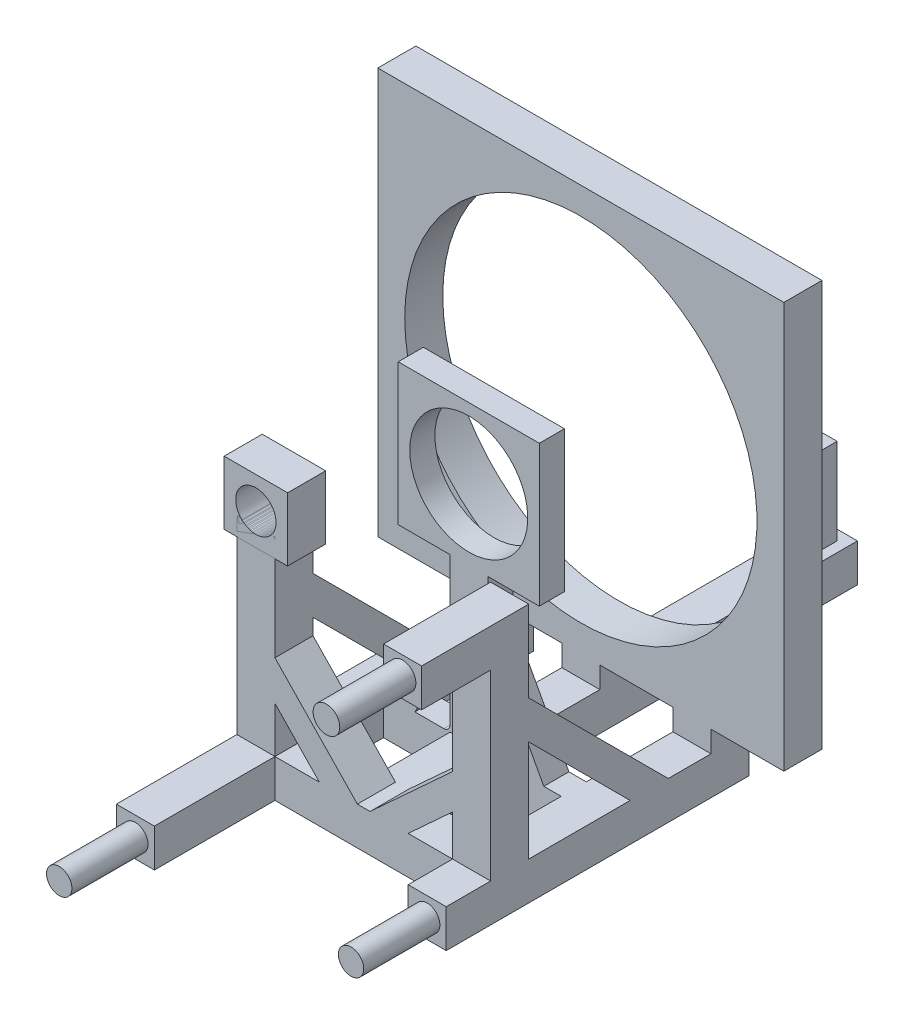
from build123d import *

# Parameters (mm, degrees)
SKETCH3_W            = 3
SKETCH3_H            = 3
SKETCH7_W            = 3
SKETCH7_H            = 3
BOSS_EXTRUDE1_DEPTH  = 16.5
SKETCH12_W           = 5
SKETCH12_H           = 5
BOSS_EXTRUDE4_DEPTH  = 1.5
SKETCH17_R           = 1
BOSS_EXTRUDE5_DEPTH  = 6
SKETCH18_R           = 1
BOSS_EXTRUDE6_DEPTH  = 6
SKETCH19_W           = 3
SKETCH19_H           = 3
BOSS_EXTRUDE7_DEPTH  = 7.54
SKETCH21_W           = 3
SKETCH21_H           = 1.98
BOSS_EXTRUDE8_DEPTH  = 17.68
SKETCH22_W           = 11.12
SKETCH22_H           = 11.12
BOSS_EXTRUDE9_DEPTH  = 0.99
SKETCH23_R           = 4.65
CUT_EXTRUDE2_DEPTH   = 2.5
SKETCH24_W           = 3
SKETCH24_H           = 3
BOSS_EXTRUDE10_DEPTH = 9.83
SKETCH25_W           = 3
SKETCH25_H           = 3
BOSS_EXTRUDE11_DEPTH = 3
SKETCH27_W           = 32
SKETCH27_H           = 32
BOSS_EXTRUDE12_DEPTH = 1.5
SKETCH28_R           = 13.88
CUT_EXTRUDE3_DEPTH   = 7
SKETCH31_W           = 3
SKETCH31_H           = 3
BOSS_EXTRUDE13_DEPTH = 17.3
SKETCH32_W           = 1.4
SKETCH32_H           = 1.4
BOSS_EXTRUDE14_DEPTH = 6.8
SKETCH33_W           = 3
SKETCH33_H           = 3
BOSS_EXTRUDE15_DEPTH = 17.37
SKETCH34_W           = 3
SKETCH34_H           = 3
BOSS_EXTRUDE16_DEPTH = 5.5
SKETCH36_W           = 3
SKETCH36_H           = 3
SKETCH16_R           = 1.59
CUT_EXTRUDE7_DEPTH   = 5
SKETCH41_W           = 3
SKETCH41_H           = 3
BOSS_EXTRUDE17_DEPTH = 17.37
SKETCH42_W           = 3
SKETCH42_H           = 3
BOSS_EXTRUDE18_DEPTH = 5
SKETCH43_W           = 3
SKETCH43_H           = 3
BOSS_EXTRUDE19_DEPTH = 17.4
SKETCH47_W           = 3
SKETCH47_H           = 3
SKETCH53_W           = 3
SKETCH53_H           = 3
BOSS_EXTRUDE20_REACH = 63.391
SKETCH55_W           = 1.98
SKETCH55_H           = 3
BOSS_EXTRUDE21_REACH = 63.391
SKETCH56_W           = 1.98
SKETCH56_H           = 3
FILLET1_R            = 0.5
FILLET2_R            = 0.5
SKETCH57_W           = 1.98
SKETCH57_H           = 3
SKETCH59_W           = 3
SKETCH59_H           = 3
BOSS_EXTRUDE22_DEPTH = 5.44
SKETCH63_R           = 1.05
BOSS_EXTRUDE25_DEPTH = 6


with BuildPart() as part:
    # Sweep3: sweep along a path in Sketch4
    with BuildLine(Plane(origin=(0, 0, 0), x_dir=(1, 0, 0), z_dir=(0, 1, 0))) as sweep3_path:
        Line((0, 0), (0, 11))
        Line((0, 11), (17, 11))
        Line((17, 11), (17, 6))
    # Sketch3 → Sweep3 (sweep)
    with BuildSketch(Plane.XY):
        Rectangle(SKETCH3_W, SKETCH3_H)
    sweep(path=sweep3_path.line, transition=Transition.RIGHT)

    # Sketch7 → Boss-Extrude1 (add)
    with BuildSketch(Plane(origin=(0, 0, 0), x_dir=(1, 0, 0), z_dir=(0, 1, 0))):
        with Locations((0, 11)):
            Rectangle(SKETCH7_W, SKETCH7_H)
    extrude(amount=BOSS_EXTRUDE1_DEPTH)

    # Sketch17 → Boss-Extrude5 (add)
    with BuildSketch(Plane.XY):
        Circle(SKETCH17_R)
    extrude(amount=BOSS_EXTRUDE5_DEPTH)

    # Sketch18 → Boss-Extrude6 (add)
    with BuildSketch(Plane.XY.offset(-6)):
        with Locations((17, 0)):
            Circle(SKETCH18_R)
    extrude(amount=BOSS_EXTRUDE6_DEPTH)

    # Sweep4: sweep along a path in Sketch39
    with BuildLine(Plane.XY.offset(-11)) as sweep4_path:
        Line((6.5, 1.5), (0, 8.24))
    # Sketch36 → Sweep4 (sweep)
    with BuildSketch(Plane(origin=(0, 1.5, 0), x_dir=(1, 0, 0), z_dir=(0, 1, 0))):
        with Locations((6.5, 11)):
            Rectangle(SKETCH36_W, SKETCH36_H)
    sweep(path=sweep4_path.line)


with BuildPart() as body_2:
    # Sketch12 → Boss-Extrude4 (new, symmetric)
    with BuildSketch(Plane.XY.offset(-11)):
        with Locations((0, 17.5)):
            Rectangle(SKETCH12_W, SKETCH12_H)
    extrude(amount=BOSS_EXTRUDE4_DEPTH, both=True)


with BuildPart() as body_3:
    # Sketch19 → Boss-Extrude7 (new body)
    with BuildSketch(Plane.XY.offset(-12.5)):
        with Locations((8.24, 0)):
            Rectangle(SKETCH19_W, SKETCH19_H)
    extrude(amount=-BOSS_EXTRUDE7_DEPTH)

    # Sketch21 → Boss-Extrude8 (add)
    with BuildSketch(Plane(origin=(0, 1.5, 0), x_dir=(1, 0, 0), z_dir=(0, 1, 0))):
        with Locations((8.24, 19.05)):
            Rectangle(SKETCH21_W, SKETCH21_H)
    extrude(amount=BOSS_EXTRUDE8_DEPTH)

    # Sketch22 → Boss-Extrude9 (add, symmetric)
    with BuildSketch(Plane.XY.offset(-19.05)):
        with Locations((8.217064706, 19.179985124)):
            Rectangle(SKETCH22_W, SKETCH22_H)
    extrude(amount=BOSS_EXTRUDE9_DEPTH, both=True)

    # Sketch23 → Cut-Extrude2 (cut, symmetric)
    with BuildSketch(Plane(origin=(0, 0, -20.04), x_dir=(-1, 0, 0), z_dir=(0, 0, -1))):
        with Locations((-8.217064706, 19.179985124)):
            Circle(SKETCH23_R)
    extrude(amount=CUT_EXTRUDE2_DEPTH, both=True, mode=Mode.SUBTRACT)

    # Sketch24 → Boss-Extrude10 (add)
    with BuildSketch(Plane(origin=(0, 0, -20.04), x_dir=(-1, 0, 0), z_dir=(0, 0, -1))):
        with Locations((-8.24, 0)):
            Rectangle(SKETCH24_W, SKETCH24_H)
    extrude(amount=BOSS_EXTRUDE10_DEPTH)

    # Sketch25 → Boss-Extrude11 (add)
    with BuildSketch(Plane(origin=(0, 1.5, 0), x_dir=(1, 0, 0), z_dir=(0, 1, 0))):
        with Locations((8.24, 28.37)):
            Rectangle(SKETCH25_W, SKETCH25_H)
    extrude(amount=BOSS_EXTRUDE11_DEPTH)

    # Sketch27 → Boss-Extrude12 (add, symmetric)
    with BuildSketch(Plane(origin=(0, 0, -28.37), x_dir=(-1, 0, 0), z_dir=(0, 0, -1))):
        with Locations((-8.24, 19.18)):
            Rectangle(SKETCH27_W, SKETCH27_H)
    extrude(amount=BOSS_EXTRUDE12_DEPTH, both=True)

    # Sketch28 → Cut-Extrude3 (cut)
    with BuildSketch(Plane(origin=(0, 0, -29.87), x_dir=(-1, 0, 0), z_dir=(0, 0, -1))):
        with Locations((-8.24, 19.18)):
            Circle(SKETCH28_R)
    extrude(amount=-CUT_EXTRUDE3_DEPTH, mode=Mode.SUBTRACT)

    # Sketch31 → Boss-Extrude13 (add)
    with BuildSketch(Plane(origin=(0, 0, -29.87), x_dir=(-1, 0, 0), z_dir=(0, 0, -1))):
        with Locations((-8.24, 0)):
            Rectangle(SKETCH31_W, SKETCH31_H)
    extrude(amount=BOSS_EXTRUDE13_DEPTH)

    # Sketch32 → Boss-Extrude14 (add)
    with BuildSketch(Plane(origin=(0, 1.5, 0), x_dir=(1, 0, 0), z_dir=(0, 1, 0))):
        with Locations((8.24, 45.67)):
            Rectangle(SKETCH32_W, SKETCH32_H)
    extrude(amount=BOSS_EXTRUDE14_DEPTH)



with BuildPart() as body_4:
    # Sketch33 → Boss-Extrude15 (new body)
    with BuildSketch(Plane(origin=(0, 0, -12.5), x_dir=(-1, 0, 0), z_dir=(0, 0, -1))):
        with Locations((-17, 0)):
            Rectangle(SKETCH33_W, SKETCH33_H)
    extrude(amount=BOSS_EXTRUDE15_DEPTH)

    # Sketch34 → Boss-Extrude16 (add)
    with BuildSketch(Plane(origin=(0, 1.5, 0), x_dir=(1, 0, 0), z_dir=(0, 1, 0))):
        with Locations((17, 28.37)):
            Rectangle(SKETCH34_W, SKETCH34_H)
    extrude(amount=BOSS_EXTRUDE16_DEPTH)


with BuildPart() as cut_extrude7_tool:
    # Sketch16 → Cut-Extrude7 (new, symmetric)
    with BuildSketch(Plane(origin=(0, 0, -12.5), x_dir=(-1, 0, 0), z_dir=(0, 0, -1))):
        with Locations(Location((0, 17.5, 0), (0, 0, 180))):
            Circle(SKETCH16_R)
    extrude(amount=CUT_EXTRUDE7_DEPTH, both=True)


with BuildPart() as part_1:
    add(part.part)

    # Cut-Extrude7: cut by cut_extrude7_tool
    add(cut_extrude7_tool.part, mode=Mode.SUBTRACT)


with BuildPart() as body_2_1:
    add(body_2.part)

    # Cut-Extrude7: cut by cut_extrude7_tool
    add(cut_extrude7_tool.part, mode=Mode.SUBTRACT)


with BuildPart() as body_3_1:
    add(body_3.part)

    add(part_1.part)  # Boss-Extrude17 merges part
    # Sketch41 → Boss-Extrude17 (add)
    with BuildSketch(Plane(origin=(0, 0, -12.5), x_dir=(-1, 0, 0), z_dir=(0, 0, -1))):
        Rectangle(SKETCH41_W, SKETCH41_H)
    extrude(amount=BOSS_EXTRUDE17_DEPTH)

    # Sketch42 → Boss-Extrude18 (add)
    with BuildSketch(Plane(origin=(0, 1.5, 0), x_dir=(1, 0, 0), z_dir=(0, 1, 0))):
        with Locations((0, 28.37)):
            Rectangle(SKETCH42_W, SKETCH42_H)
    extrude(amount=BOSS_EXTRUDE18_DEPTH)


    add(body_4.part)  # Boss-Extrude19 merges body 4
    # Sketch43 → Boss-Extrude19 (add)
    with BuildSketch(Plane(origin=(0, 1.5, 0), x_dir=(1, 0, 0), z_dir=(0, 1, 0))):
        with Locations((17, 11)):
            Rectangle(SKETCH43_W, SKETCH43_H)
    extrude(amount=BOSS_EXTRUDE19_DEPTH)

    # Sweep5: sweep along a path in Sketch51
    with BuildLine(Plane.XY.offset(-11)) as sweep5_path:
        Line((10.5, 1.5), (17, 7.472026952))
    # Sketch47 → Sweep5 (sweep)
    with BuildSketch(Plane(origin=(0, 1.5, 0), x_dir=(1, 0, 0), z_dir=(0, 1, 0))):
        with Locations((10.5, 11)):
            Rectangle(SKETCH47_W, SKETCH47_H)
    sweep(path=sweep5_path.line)

    # Sweep6: sweep along a path in Sketch54
    with BuildLine(Plane.ZY.offset(1.5)) as sweep6_path:
        Line((-12.5, 11), (-23.5, 0))
    # Sketch53 → Sweep6 (sweep)
    with BuildSketch(Plane.XY.offset(-12.5)):
        with Locations((0, 11)):
            Rectangle(SKETCH53_W, SKETCH53_H)
    sweep6 = sweep(path=sweep6_path.line)

    # Mirror11: Sweep6 across plane
    add(sweep6.mirror(Plane.ZY.offset(-8.5)))

    # Sketch55 → Boss-Extrude20 (add, up to next)
    with BuildSketch(Plane.ZY.offset(-6.74), mode=Mode.PRIVATE) as boss_extrude20_sk1:
        with Locations((-19.05, 0)):
            Rectangle(SKETCH55_W, SKETCH55_H)
    boss_extrude20_tool1 = extrude(boss_extrude20_sk1.sketch, amount=BOSS_EXTRUDE20_REACH, mode=Mode.PRIVATE) - body_3_1.part
    add(boss_extrude20_tool1.solids().sort_by_distance((6.74, 0, -19.05))[0])

    # Sketch56 → Boss-Extrude21 (add, up to next)
    with BuildSketch(Plane(origin=(9.74, 0, 0), x_dir=(0, 0, -1), z_dir=(1, 0, 0)), mode=Mode.PRIVATE) as boss_extrude21_sk1:
        with Locations((19.05, 0)):
            Rectangle(SKETCH56_W, SKETCH56_H)
    boss_extrude21_tool1 = extrude(boss_extrude21_sk1.sketch, amount=BOSS_EXTRUDE21_REACH, mode=Mode.PRIVATE) - body_3_1.part
    add(boss_extrude21_tool1.solids().sort_by_distance((9.74, 0, -19.05))[0])

    # Fillet1
    # the kernel refuses this fillet: 0.5 mm, written as the material it adds along each edge
    with BuildSketch(Plane(origin=(6.74, 1.5, -20.04), x_dir=(-1, 0, 0), z_dir=(0, 0, 1))) as fillet1_piece_1:
        with BuildLine():
            CenterArc((FILLET1_R, -FILLET1_R), FILLET1_R, 90, 90)
            Line((0, -FILLET1_R), (0, 0))
            Line((0, 0), (FILLET1_R, 0))
        make_face()
    extrude(amount=1.98)

    # Fillet2
    # the kernel refuses this fillet: 0.5 mm, written as the material it adds along each edge
    with BuildSketch(Plane(origin=(9.74, 1.5, -18.06), x_dir=(0, 1, 0), z_dir=(0, 0, -1))) as fillet2_piece_1:
        with BuildLine():
            CenterArc((FILLET2_R, FILLET2_R), FILLET2_R, 180, 90)
            Line((0, FILLET2_R), (0, 0))
            Line((0, 0), (FILLET2_R, 0))
        make_face()
    extrude(amount=1.98)

    # Sweep7: sweep along a path in Sketch58
    with BuildLine(Plane.XY.offset(-19.05)) as sweep7_path:
        Line((6.74, 8.119985124), (2.349216677, 0))
    # Sketch57 → Sweep7 (sweep)
    with BuildSketch(Plane.ZY.offset(-6.74)):
        with Locations((-19.05, 8.119985124)):
            Rectangle(SKETCH57_W, SKETCH57_H)
    sweep7 = sweep(path=sweep7_path.line)

    # Mirror13: Sweep7 across plane
    add(sweep7.mirror(Plane.ZY.offset(-8.24)))

    # Sketch59 → Boss-Extrude22 (add)
    with BuildSketch(Plane.XY.offset(-9.5)):
        with Locations((17, 17.4)):
            Rectangle(SKETCH59_W, SKETCH59_H)
    extrude(amount=BOSS_EXTRUDE22_DEPTH)

    # Sketch63 → Boss-Extrude25 (add)
    with BuildSketch(Plane.XY.offset(-4.06)):
        with Locations((17, 17.5)):
            Circle(SKETCH63_R)
    extrude(amount=BOSS_EXTRUDE25_DEPTH)


solid = Compound([body_2_1.part, body_3_1.part])
